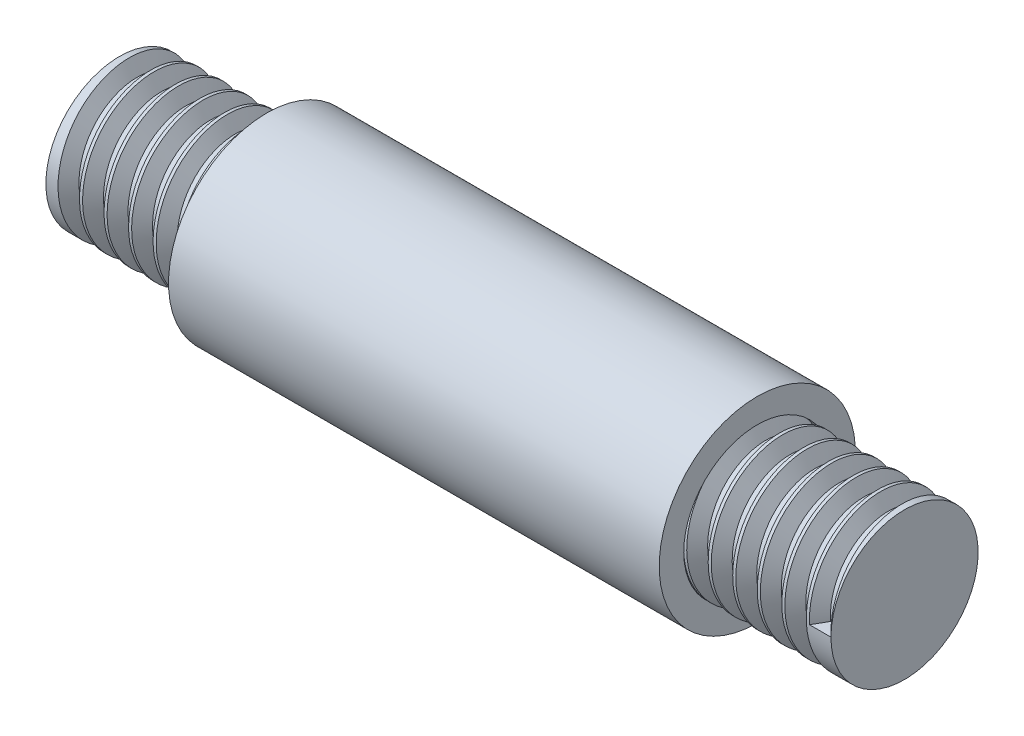
from build123d import *
from build123d.topology import SkipClean

# Parameters (mm, degrees)
THREAD1_PITCH = 0.5
THREAD2_PITCH = 0.5


with BuildPart() as part:
    # Sketch1 → Revolve1 (revolve)
    with BuildSketch(Plane.XY):
        Polygon((0, 0), (0, 1.5), (3, 1.5), (3, 2), (13, 2), (13, 1.5), (16, 1.5), (16, 0), align=None)
    revolve(axis=Axis((16, 0, 0), (-1, 0, 0)))

    # Thread1: the profile of Thread Profile1 profile screwed along a right-hand helix of 6 turns, 6 arcs to a turn; built about Z, then put on its axis
    with SkipClean():  # the faces are left unmerged after this step: merging them gives an invalid solid
        thread1_z = Axis((0, 0, 0), (0, 0, 1))
        thread1_corners = [(1.5003, 0, -0.000173205), (1.5003, 0, 0.437673204), (1.229367062, 0, 0.281249999), (1.229367062, 0, 0.156249999)]
        with BuildLine(mode=Mode.PRIVATE) as thread1_profile:
            Line(thread1_corners[0], thread1_corners[1])
            Line(thread1_corners[1], thread1_corners[2])
            Line(thread1_corners[2], thread1_corners[3])
            Line(thread1_corners[3], thread1_corners[0])
        thread1_cap = Face(thread1_profile.wire())
        thread1_turn_angles = [0, 30, 60, 90, 120, 150, 180, 210, 240, 270, 300, 330, 360]
        thread1_turn_weights = [1, 0.8660254037844387, 1, 0.8660254037844387, 1, 0.8660254037844387, 1, 0.8660254037844387, 1, 0.8660254037844387, 1, 0.8660254037844387, 1]
        thread1_turn_rails = [Edge.make_bspline([Vector(p[0], p[1], 0).rotate(thread1_z, thread1_turn_angles[k]) / thread1_turn_weights[k] + Vector(0, 0, p[2] + THREAD1_PITCH * thread1_turn_angles[k] / 360) for k in range(13)], [0, 0, 0, 1, 1, 2, 2, 3, 3, 4, 4, 5, 5, 6, 6, 6], 2, thread1_turn_weights) for p in thread1_corners]
        thread1_turn_sides = [Face.make_surface_from_curves(thread1_turn_rails[p[0]], thread1_turn_rails[p[1]]) for p in [(0, 1), (1, 2), (2, 3), (3, 0)]]
        thread1 = Plane(origin=(0, 0, 0), x_dir=(0, 0, -1), z_dir=(1, 0, 0)) * Solid(Shell([*[p.moved(Location((0, 0, THREAD1_PITCH * i))) for i in range(6) for p in thread1_turn_sides], thread1_cap, thread1_cap.rotate(thread1_z, 2160).moved(Location((0, 0, THREAD1_PITCH * 2160 / 360)))]))
        add(thread1, mode=Mode.SUBTRACT)

    # Thread2: the profile of Thread Profile2 profile screwed along a right-hand helix of 6 turns, 6 arcs to a turn; built about Z, then put on its axis
    with SkipClean():  # the faces are left unmerged after this step: merging them gives an invalid solid
        thread2_z = Axis((0, 0, 0), (0, 0, 1))
        thread2_corners = [(1.5003, 0, -0.000173205), (1.5003, 0, 0.437673204), (1.229367063, 0, 0.281249999), (1.229367062, 0, 0.156249999)]
        with BuildLine(mode=Mode.PRIVATE) as thread2_profile:
            Line(thread2_corners[0], thread2_corners[1])
            Line(thread2_corners[1], thread2_corners[2])
            Line(thread2_corners[2], thread2_corners[3])
            Line(thread2_corners[3], thread2_corners[0])
        thread2_cap = Face(thread2_profile.wire())
        thread2_turn_angles = [0, 30, 60, 90, 120, 150, 180, 210, 240, 270, 300, 330, 360]
        thread2_turn_weights = [1, 0.8660254037844387, 1, 0.8660254037844387, 1, 0.8660254037844387, 1, 0.8660254037844387, 1, 0.8660254037844387, 1, 0.8660254037844387, 1]
        thread2_turn_rails = [Edge.make_bspline([Vector(p[0], p[1], 0).rotate(thread2_z, thread2_turn_angles[k]) / thread2_turn_weights[k] + Vector(0, 0, p[2] + THREAD2_PITCH * thread2_turn_angles[k] / 360) for k in range(13)], [0, 0, 0, 1, 1, 2, 2, 3, 3, 4, 4, 5, 5, 6, 6, 6], 2, thread2_turn_weights) for p in thread2_corners]
        thread2_turn_sides = [Face.make_surface_from_curves(thread2_turn_rails[p[0]], thread2_turn_rails[p[1]]) for p in [(0, 1), (1, 2), (2, 3), (3, 0)]]
        thread2 = Plane(origin=(16, 0, 0), x_dir=(0, 0, 1), z_dir=(-1, 0, 0)) * Solid(Shell([*[p.moved(Location((0, 0, THREAD2_PITCH * i))) for i in range(6) for p in thread2_turn_sides], thread2_cap, thread2_cap.rotate(thread2_z, 2160).moved(Location((0, 0, THREAD2_PITCH * 2160 / 360)))]))
        add(thread2, mode=Mode.SUBTRACT)


solid = part.part
